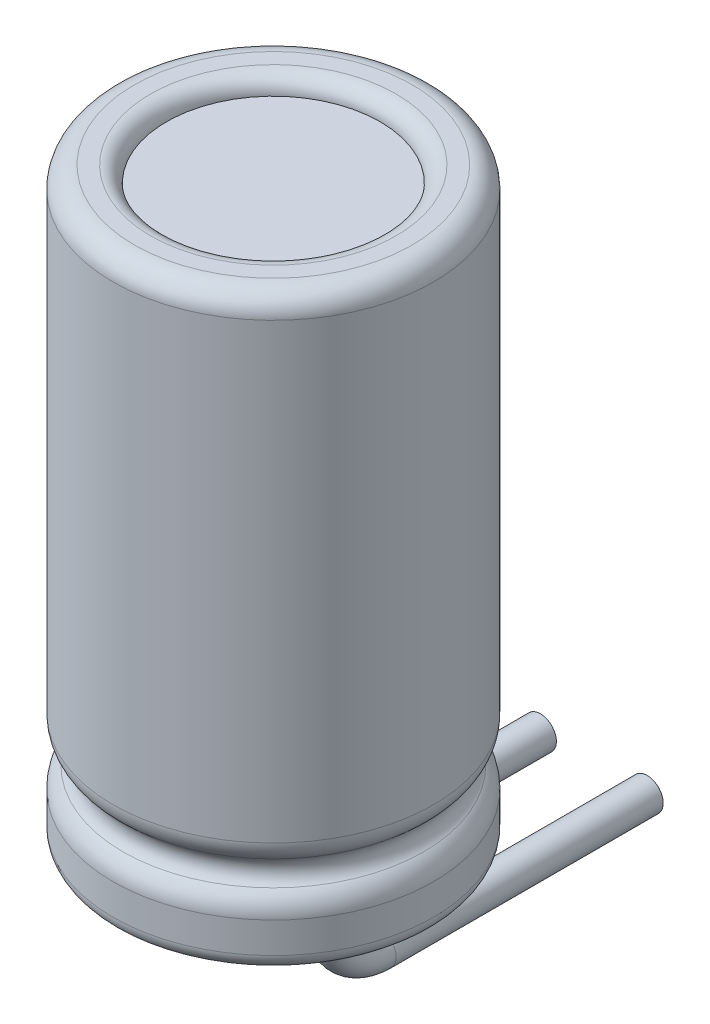
from build123d import *

# Parameters (mm, degrees)
SKETCH_2_R          = 3
EXTRUDE_1_DEPTH     = 11
SKETCH_3_R          = 2
CUT_EXTRUDE_1_DEPTH = 0.3
SKETCH_4_R          = 0.3
CUT_EXTRUDE_START   = -0.3
SKETCH_7_R          = 2
CUT_EXTRUDE_2_DEPTH = 0.3
FILLET_2_R          = 0.5
FILLET_3_R          = 0.4
FILLET_4_R          = 0.3
FILLET_5_R          = 0.3
FILLET_6_R          = 0.3


with BuildPart() as part:
    # Эскиз2 → Бобышка-Вытянуть1 (new body)
    with BuildSketch(Plane(origin=(0, 0, 0), x_dir=(1, 0, 0), z_dir=(0, 1, 0))):
        with Locations(Location((0, 0, 0), (0, 0, 270))):
            Circle(SKETCH_2_R)
    extrude(amount=EXTRUDE_1_DEPTH)

    # Эскиз3 → Вырез-Вытянуть1 (cut)
    with BuildSketch(Plane.XZ):
        with Locations(Location((0, 0, 0), (0, 0, 270))):
            Circle(SKETCH_3_R)
    extrude(amount=-CUT_EXTRUDE_1_DEPTH, mode=Mode.SUBTRACT)

    # Эскиз7 → Вырез-Вытянуть2 (cut)
    with BuildSketch(Plane(origin=(0, 11, 0), x_dir=(1, 0, 0), z_dir=(0, 1, 0)).offset(CUT_EXTRUDE_START)):
        with Locations(Location((0, 0, 0), (0, 0, 90))):
            Circle(SKETCH_7_R)
    extrude(amount=CUT_EXTRUDE_2_DEPTH, mode=Mode.SUBTRACT)

    # Эскиз9 → Вырез-Повернуть1 (revolve, cut)
    with BuildSketch(Plane(origin=(0, 0, 0), x_dir=(0, 0, -1), z_dir=(1, 0, 0)), mode=Mode.PRIVATE) as cut_revolve_1_sk:
        with BuildLine():
            Line((-3, 1.8), (-3, 1.2))
            ThreePointArc((-3, 1.2), (-2.7, 1.5), (-3, 1.8))
        make_face()
    revolve(cut_revolve_1_sk.sketch.rotate(Axis((0, -2.369211138, 0), (0, 1, 0)), 180), axis=Axis((0, -2.369211138, 0), (0, 1, 0)), mode=Mode.SUBTRACT)

    # Скругление2
    fillet_2_edges = [part.edges().sort_by_distance(p)[0] for p in [
        (-3, 1.2, 0),
        (-3, 1.8, 0),
    ]]
    fillet(fillet_2_edges, radius=FILLET_2_R)

    # Скругление3
    fillet_3_edges = [part.edges().sort_by_distance(p)[0] for p in [
        (0, 11, -3),
    ]]
    fillet(fillet_3_edges, radius=FILLET_3_R)

    # Скругление4
    fillet_4_edges = [part.edges().sort_by_distance(p)[0] for p in [
        (0, 11, 2),
    ]]
    fillet(fillet_4_edges, radius=FILLET_4_R - 0.0001)  # a hair under: the kernel refuses the full size

    # Скругление5
    fillet_5_edges = [part.edges().sort_by_distance(p)[0] for p in [
        (0, 0, 2),
    ]]
    fillet(fillet_5_edges, radius=FILLET_5_R - 0.0001)  # a hair under: the kernel refuses the full size

    # Скругление6
    fillet_6_edges = [part.edges().sort_by_distance(p)[0] for p in [
        (0, 0, -3),
    ]]
    fillet(fillet_6_edges, radius=FILLET_6_R)


with BuildPart() as body_2:
    # По траектории1: sweep along a path in Эскиз6
    with BuildLine(Plane.ZY.offset(1)) as sweep_1_path:
        Line((0, 0.3), (0, -0.7))
        ThreePointArc((0, -0.7), (-0.292893219, -1.407106781), (-1, -1.7))
        Line((-1, -1.7), (-6, -1.7))
    # Эскиз4 → По траектории1 (sweep)
    with BuildSketch(Plane.XZ.offset(-0.3)):
        with Locations((-1, 0)):
            Circle(SKETCH_4_R)
    sweep(path=sweep_1_path.line)


with BuildPart() as body_3:
    # Зеркальное отражение1: mirrored copy
    add(body_2.part.mirror(Plane(origin=(0, 0, 0), x_dir=(0, 0, 1), z_dir=(1, 0, 0))))


solid = Compound([part.part, body_2.part, body_3.part])
